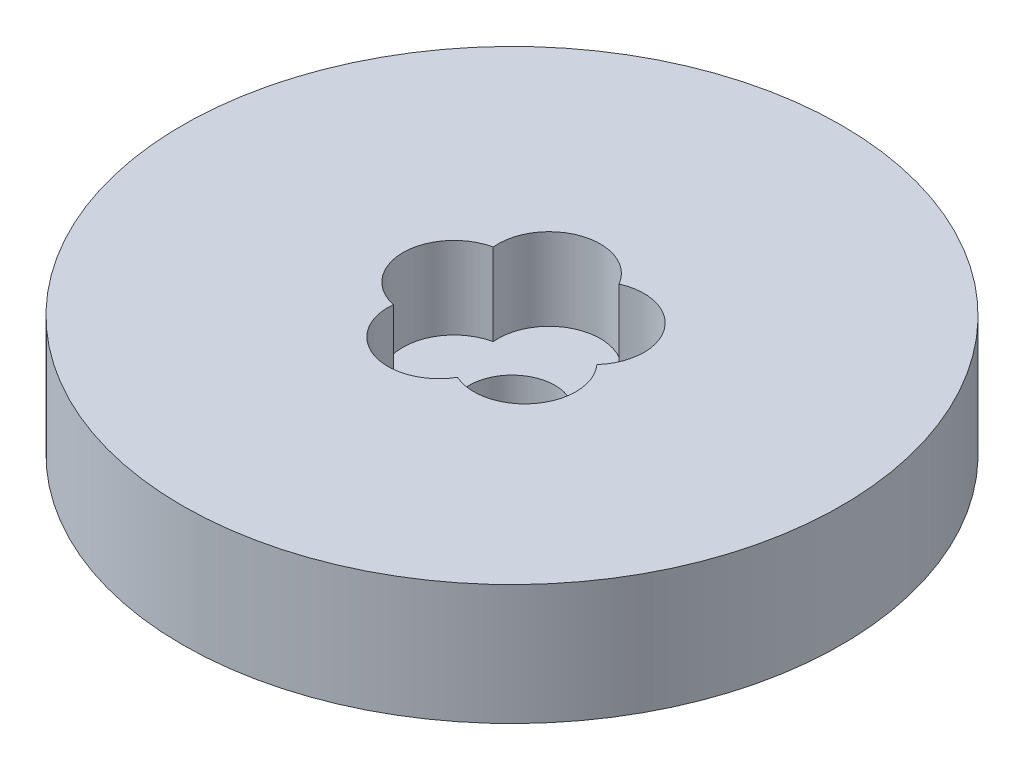
from build123d import *

# Parameters (mm, degrees)
SKETCH1_R           = 57.5
BOSS_EXTRUDE1_DEPTH = 21
SKETCH2_R           = 7.5
CUT_EXTRUDE1_DEPTH  = 84.985117729
SKETCH3_R           = 8.914028006
CUT_EXTRUDE2_DEPTH  = 14.300030393
CIRPATTERN1_COUNT   = 5


with BuildPart() as part:
    # Sketch1 → Boss-Extrude1 (new body)
    with BuildSketch(Plane(origin=(0, 0, 0), x_dir=(1, 0, 0), z_dir=(0, 1, 0))):
        Circle(SKETCH1_R)
    extrude(amount=BOSS_EXTRUDE1_DEPTH)

    # Sketch2 → Cut-Extrude1 (cut, through all)
    with BuildSketch(Plane(origin=(0, 0, 0), x_dir=(1, 0, 0), z_dir=(0, 1, 0))):
        Circle(SKETCH2_R)
    extrude(amount=CUT_EXTRUDE1_DEPTH, mode=Mode.SUBTRACT)

    # Sketch3 → Cut-Extrude2 (cut)
    with BuildSketch(Plane(origin=(0, 21, 0), x_dir=(1, 0, 0), z_dir=(0, 1, 0))):
        with Locations((-10.109024176, 0)):
            Circle(SKETCH3_R)
    cut_extrude2 = extrude(amount=-CUT_EXTRUDE2_DEPTH, mode=Mode.SUBTRACT)

    # CirPattern1: Cut-Extrude2 ×5 about axis
    cirpattern1_axis = Axis((0, 0, 0), (0, 1, 0))
    for i in range(1, CIRPATTERN1_COUNT):
        add(cut_extrude2.rotate(cirpattern1_axis, i * 360 / CIRPATTERN1_COUNT), mode=Mode.SUBTRACT)


solid = part.part
